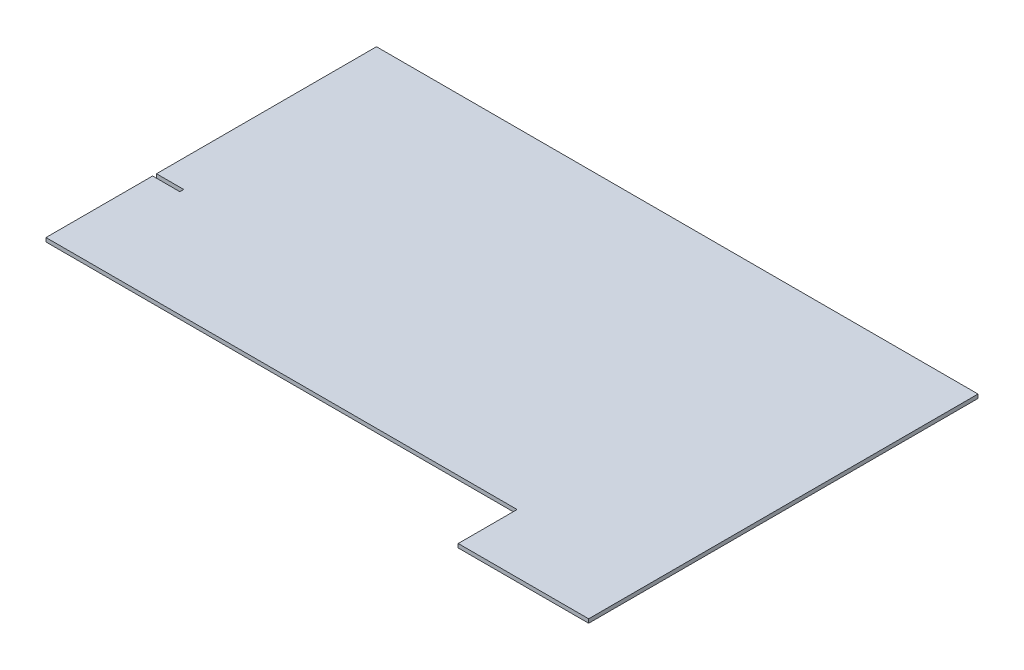
from build123d import *

# Parameters (mm, degrees)
BOSS_EXTRUDE1_DEPTH = 2
SKETCH2_W           = 14
SKETCH2_H           = 2
CUT_EXTRUDE1_DEPTH  = 10


with BuildPart() as part:
    # Sketch1 → Boss-Extrude1 (new body)
    with BuildSketch(Plane(origin=(0, 0, 0), x_dir=(1, 0, 0), z_dir=(0, 1, 0))):
        Polygon((242, 0), (242, -30.24), (309, -30.24), (309, 169.76), (0, 169.76), (0, 0), align=None)
    extrude(amount=BOSS_EXTRUDE1_DEPTH)

    # Sketch2 → Cut-Extrude1 (cut)
    with BuildSketch(Plane(origin=(0, 2, 0), x_dir=(1, 0, 0), z_dir=(0, 1, 0))):
        with Locations((7, 55.76)):
            Rectangle(SKETCH2_W, SKETCH2_H)
    extrude(amount=-CUT_EXTRUDE1_DEPTH, mode=Mode.SUBTRACT)


solid = part.part
